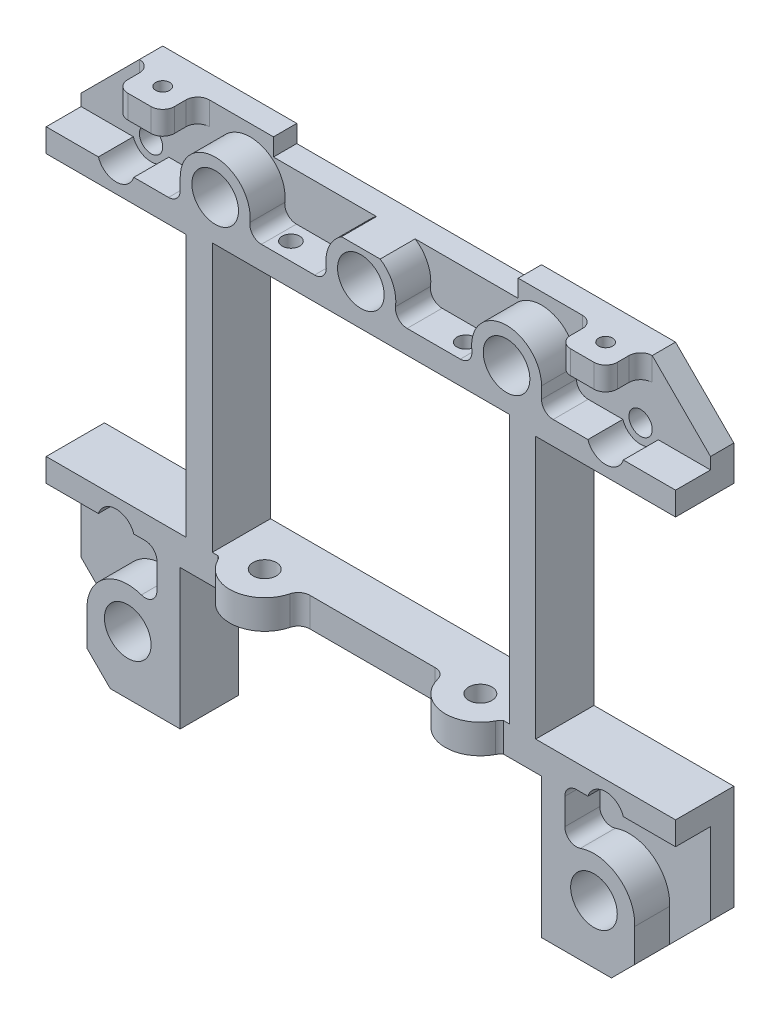
from build123d import *

# Parameters (mm, degrees)
SKETCH_1_R          = 2
SKETCH_1_R_2        = 1
SKETCH_1_W          = 25.5
SKETCH_1_H          = 23
EXTRUDE_1_DEPTH     = 2
SKETCH_3_R          = 1
EXTRUDE_2_DEPTH     = 2.5
SKETCH_4_R          = 2
SKETCH_4_W          = 4
SKETCH_4_H          = 2
EXTRUDE_3_DEPTH     = 3
FILLET_1_R          = 1
FILLET_2_R          = 1
SKETCH_5_W          = 12.5
SKETCH_5_H          = 2.5
EXTRUDE_4_DEPTH     = 2
FILLET_3_R          = 1
SKETCH_6_R          = 2
CUT_EXTRUDE_1_DEPTH = 1
SKETCH_7_R          = 0.75
CUT_EXTRUDE_2_DEPTH = 2.5
SKETCH_8_R          = 0.6
CUT_EXTRUDE_3_DEPTH = 3
SKETCH1_W           = 21
SKETCH1_H           = 10
CUT_EXTRUDE1_DEPTH  = 1.5
SKETCH3_R           = 0.75
CUT_EXTRUDE2_DEPTH  = 11


with BuildPart() as part:
    # 草图1 → 凸台-拉伸1 (new body)
    with BuildSketch(Plane.XY):
        Polygon((-27, 25), (-15, 25), (-15, 2.5), (-27, 2.5), (-27, -6.5), (-21.5, -12), (-15.5, -12), (-15.5, 0), (15.5, 0), (15.5, -12), (21.5, -12), (27, -6.5), (27, 2.5), (15, 2.5), (15, 25), (27, 25), (27, 28), (22, 33), (-22, 33), (-27, 28), align=None)
        with Locations((20, -7)):
            Circle(SKETCH_1_R, mode=Mode.SUBTRACT)
        with Locations((12.5, 29)):
            Circle(SKETCH_1_R, mode=Mode.SUBTRACT)
        with Locations((0, 29)):
            Circle(SKETCH_1_R, mode=Mode.SUBTRACT)
        with Locations(Location((-20, -7, 0), (0, 0, 180))):
            Circle(SKETCH_1_R, mode=Mode.SUBTRACT)
        with Locations(Location((-12.5, 29, 0), (0, 0, 180))):
            Circle(SKETCH_1_R, mode=Mode.SUBTRACT)
        with Locations((21, 27.5)):
            Circle(SKETCH_1_R_2, mode=Mode.SUBTRACT)
        with Locations((21, 0)):
            Circle(SKETCH_1_R_2, mode=Mode.SUBTRACT)
        with Locations(Location((-21, 27.5, 0), (0, 0, 180))):
            Circle(SKETCH_1_R_2, mode=Mode.SUBTRACT)
        with Locations(Location((-21, 0, 0), (0, 0, 180))):
            Circle(SKETCH_1_R_2, mode=Mode.SUBTRACT)
        with Locations((0, 14)):
            Rectangle(SKETCH_1_W, SKETCH_1_H, mode=Mode.SUBTRACT)
    extrude(amount=EXTRUDE_1_DEPTH)

    # 草图3 → 凸台-拉伸2 (add)
    # profile 1 of 2: a face of its own
    with BuildSketch(Plane(origin=(0, 2.5, 0), x_dir=(1, 0, 0), z_dir=(0, 1, 0))):
        with BuildLine():
            Line((-6.25, -2), (-6.25, -4))
            ThreePointArc((-6.25, -4), (-9.25, -7), (-12.25, -4))
            Line((-12.25, -4), (-12.25, -2))
            Line((-12.25, -2), (-6.25, -2))
        make_face()
        with Locations(Location((-9.25, -4, 0), (0, 0, 180))):
            Circle(SKETCH_3_R, mode=Mode.SUBTRACT)
    # profile 2 of 2: a face of its own
    with BuildSketch(Plane(origin=(0, 2.5, 0), x_dir=(1, 0, 0), z_dir=(0, 1, 0))):
        with BuildLine():
            Line((12.25, -2), (6.25, -2))
            Line((6.25, -2), (6.25, -4))
            ThreePointArc((6.25, -4), (9.25, -7), (12.25, -4))
            Line((12.25, -4), (12.25, -2))
        make_face()
        with Locations((9.25, -4)):
            Circle(SKETCH_3_R, mode=Mode.SUBTRACT)
    extrude(amount=-EXTRUDE_2_DEPTH)

    # 草图4 → 凸台-拉伸3 (add)
    # profile 1 of 3: a face of its own
    with BuildSketch(Plane.XY.offset(2)):
        with BuildLine():
            Line((-15.5, 29), (-15.5, 27))
            Line((-15.5, 27), (-19.480131585, 27))
            ThreePointArc((-19.480131585, 27), (-21, 25.9), (-22.519868415, 27))
            Line((-22.519868415, 27), (-27, 27))
            Line((-27, 27), (-27, 25))
            Line((-27, 25), (-16.5, 25))
            Line((-16.5, 25), (-15, 25))
            Line((-15, 25), (-15, 2.5))
            Line((-15, 2.5), (-27, 2.5))
            Line((-27, 2.5), (-27, 0.5))
            Line((-27, 0.5), (-25, 0.5))
            Line((-25, 0.5), (-22.519868415, 0.5))
            ThreePointArc((-22.519868415, 0.5), (-21, 1.6), (-19.480131585, 0.5))
            Line((-19.480131585, 0.5), (-17.5, 0.5))
            Line((-17.5, 0.5), (-17.5, -4.550510257))
            ThreePointArc((-17.5, -4.550510257), (-21.403955533, -3.793926254), (-23.495572013, -7.176000862))
            Line((-23.495572013, -7.176000862), (-23.495572013, -10.004427987))
            Line((-23.495572013, -10.004427987), (-21.5, -12))
            Line((-21.5, -12), (-15.5, -12))
            Line((-15.5, -12), (-15.5, 0))
            Line((-15.5, 0), (-12.25, 0))
            Line((-12.25, 0), (-12.25, 2.5))
            Line((-12.25, 2.5), (-12.75, 2.5))
            Line((-12.75, 2.5), (-12.75, 25.5))
            Line((-12.75, 25.5), (12.75, 25.5))
            Line((12.75, 25.5), (12.75, 2.5))
            Line((12.75, 2.5), (12.25, 2.5))
            Line((12.25, 2.5), (12.25, 0))
            Line((12.25, 0), (15.5, 0))
            Line((15.5, 0), (15.5, -12))
            Line((15.5, -12), (21.5, -12))
            Line((21.5, -12), (23.495572013, -10.004427987))
            Line((23.495572013, -10.004427987), (23.495572013, -7.176000862))
            ThreePointArc((23.495572013, -7.176000862), (21.403955533, -3.793926254), (17.5, -4.550510257))
            Line((17.5, -4.550510257), (17.5, 0.5))
            Line((17.5, 0.5), (19.480131585, 0.5))
            ThreePointArc((19.480131585, 0.5), (21, 1.6), (22.519868415, 0.5))
            Line((22.519868415, 0.5), (25, 0.5))
            Line((25, 0.5), (27, 0.5))
            Line((27, 0.5), (27, 2.5))
            Line((27, 2.5), (15, 2.5))
            Line((15, 2.5), (15, 25))
            Line((15, 25), (16.5, 25))
            Line((16.5, 25), (27, 25))
            Line((27, 25), (27, 27))
            Line((27, 27), (22.519868415, 27))
            ThreePointArc((22.519868415, 27), (21, 25.9), (19.480131585, 27))
            Line((19.480131585, 27), (15.5, 27))
            Line((15.5, 27), (15.5, 29))
            ThreePointArc((15.5, 29), (11.723542865, 31.897777479), (9.901923789, 27.5))
            Line((9.901923789, 27.5), (2.598076211, 27.5))
            ThreePointArc((2.598076211, 27.5), (0, 32), (-2.598076211, 27.5))
            Line((-2.598076211, 27.5), (-9.901923789, 27.5))
            ThreePointArc((-9.901923789, 27.5), (-11.723542865, 31.897777479), (-15.5, 29))
        make_face()
        with Locations((20, -7)):
            Circle(SKETCH_4_R, mode=Mode.SUBTRACT)
        with Locations((12.5, 29)):
            Circle(SKETCH_4_R, mode=Mode.SUBTRACT)
        with Locations((0, 29)):
            Circle(SKETCH_4_R, mode=Mode.SUBTRACT)
        with Locations(Location((-12.5, 29, 0), (0, 0, 180))):
            Circle(SKETCH_4_R, mode=Mode.SUBTRACT)
        with Locations(Location((-20, -7, 0), (0, 0, 180))):
            Circle(SKETCH_4_R, mode=Mode.SUBTRACT)
    # profile 2 of 3: a face of its own
    with BuildSketch(Plane.XY.offset(2)):
        with Locations((-19, 32)):
            Rectangle(SKETCH_4_W, SKETCH_4_H)
    # profile 3 of 3: a face of its own
    with BuildSketch(Plane.XY.offset(2)):
        with Locations((19, 32)):
            Rectangle(SKETCH_4_W, SKETCH_4_H)
    extrude(amount=EXTRUDE_3_DEPTH)

    # 圆角1
    # the kernel refuses this fillet: 1 mm, written as the material it adds along each edge
    with BuildSketch(Plane(origin=(17.5, -4.550510257, 2), x_dir=(0, 1, 0), z_dir=(0, 0, 1))) as fillet_1_piece_1:
        with BuildLine():
            CenterArc((1.793150944, -1), FILLET_1_R, 90, 109.471220634)
            ThreePointArc((0.850341903, -1.333333333), (0.5014624, -0.618011305), (0, 0))
            Line((0, 0), (1.793150944, 0))
        make_face()
    extrude(amount=3)
    with BuildSketch(Plane(origin=(17.5, 0.5, 2), x_dir=(1, 0, 0), z_dir=(0, 0, 1)), Plane(origin=(15.5, 27, 2), x_dir=(0, 1, 0), z_dir=(0, 0, 1)), Plane(origin=(-15.5, 27, 2), x_dir=(-1, 0, 0), z_dir=(0, 0, 1)), Plane(origin=(-17.5, 0.5, 2), x_dir=(0, -1, 0), z_dir=(0, 0, 1))) as fillet_1_piece_2:
        with BuildLine():
            CenterArc((FILLET_1_R, -FILLET_1_R), FILLET_1_R, 90, 90)
            Line((0, -FILLET_1_R), (0, 0))
            Line((0, 0), (FILLET_1_R, 0))
        make_face()
    extrude(amount=3)
    with BuildSketch(Plane(origin=(9.901923789, 27.5, 2), x_dir=(-1, 0, 0), z_dir=(0, 0, 1)), Plane(origin=(-2.598076211, 27.5, 2), x_dir=(-1, 0, 0), z_dir=(0, 0, 1))) as fillet_1_piece_3:
        with BuildLine():
            CenterArc((1.370550755, -1), FILLET_1_R, 90, 97.180755781)
            ThreePointArc((0.378394014, -1.125), (0.245389674, -0.543599583), (0, 0))
            Line((0, 0), (1.370550755, 0))
        make_face()
    extrude(amount=3)
    with BuildSketch(Plane(origin=(2.598076211, 27.5, 2), x_dir=(0.31880013895525616, 0.9478219618694798, 0), z_dir=(0, 0, 1)), Plane(origin=(-9.901923789, 27.5, 2), x_dir=(0.3188001389552541, 0.9478219618694803, 0), z_dir=(0, 0, 1))) as fillet_1_piece_4:
        with BuildLine():
            CenterArc((1.384753733, -0.980237967), FILLET_1_R, 101.409622109, 97.180755781)
            Line((0.436931771, -1.299038106), (0, 0))
            ThreePointArc((0, 0), (0.593465886, -0.0592861), (1.186931771, 0))
        make_face()
    extrude(amount=3)
    with BuildSketch(Plane(origin=(-17.5, -4.550510257, 2), x_dir=(-0.8431291837491304, 0.5377110557823086, 0), z_dir=(0, 0, 1))) as fillet_1_piece_5:
        with BuildLine():
            CenterArc((1.807326271, -0.974146836), FILLET_1_R, 103.056735384, 109.471220635)
            Line((0.964197087, -1.511857892), (0, 0))
            ThreePointArc((0, 0), (0.790705244, -0.090486073), (1.581410487, 0))
        make_face()
    extrude(amount=3)
    with BuildSketch(Plane(origin=(-21, 33, 2), x_dir=(-1, 0, 0), z_dir=(0, -1, 0)), Plane(origin=(-17, 31, 2), x_dir=(1, 0, 0), z_dir=(0, 1, 0))) as fillet_1_piece_6:
        with BuildLine():
            CenterArc((FILLET_1_R, -FILLET_1_R), FILLET_1_R, 90, 90)
            Line((0, -FILLET_1_R), (0, 0))
            Line((0, 0), (FILLET_1_R, 0))
        make_face()
    extrude(amount=2)
    with BuildSketch(Plane(origin=(17, 31, 2), x_dir=(-1, 0, 0), z_dir=(0, 1, 0)), Plane(origin=(21, 33, 2), x_dir=(1, 0, 0), z_dir=(0, -1, 0))) as fillet_1_piece_7:
        with BuildLine():
            CenterArc((FILLET_1_R, FILLET_1_R), FILLET_1_R, 180, 90)
            Line((0, FILLET_1_R), (0, 0))
            Line((0, 0), (FILLET_1_R, 0))
        make_face()
    extrude(amount=2)
    # the kernel refuses this fillet: 1 mm, written as the material it takes off along each edge
    with BuildSketch(Plane(origin=(-21, 35.5, 5), x_dir=(0, 0, -1), z_dir=(0, -1, 0)), Plane(origin=(21, 35.5, 5), x_dir=(-1, 0, 0), z_dir=(0, -1, 0))) as fillet_1_2_piece_1:
        with BuildLine():
            CenterArc((FILLET_1_R, FILLET_1_R), FILLET_1_R, 180, 90)
            Line((0, FILLET_1_R), (0, 0))
            Line((0, 0), (FILLET_1_R, 0))
        make_face()
    extrude(amount=7, mode=Mode.SUBTRACT)
    with BuildSketch(Plane(origin=(-17, 28.5, 5), x_dir=(-1, 0, 0), z_dir=(0, 1, 0)), Plane(origin=(17, 28.5, 5), x_dir=(0, 0, -1), z_dir=(0, 1, 0))) as fillet_1_2_piece_2:
        with BuildLine():
            CenterArc((FILLET_1_R, -FILLET_1_R), FILLET_1_R, 90, 90)
            Line((0, -FILLET_1_R), (0, 0))
            Line((0, 0), (FILLET_1_R, 0))
        make_face()
    extrude(amount=7, mode=Mode.SUBTRACT)

    # 圆角2
    # the kernel refuses this fillet: 1 mm, written as the material it adds along each edge
    with BuildSketch(Plane(origin=(-12.25, 2.5, 4), x_dir=(0, 0, 1), z_dir=(0, -1, 0))) as fillet_2_piece_1:
        with BuildLine():
            CenterArc((1.830947502, 0.556350833), FILLET_2_R, 213.80380727, 28.955024372)
            ThreePointArc((1.373210626, -0.332736875), (0.706473859, -0.084370619), (0, 0))
            Line((0, 0), (1, 0))
        make_face()
    extrude(amount=2.5)
    with BuildSketch(Plane(origin=(12.25, 2.5, 4), x_dir=(0, 0, 1), z_dir=(0, -1, 0))) as fillet_2_piece_2:
        with BuildLine():
            CenterArc((1.830947502, -0.556350833), FILLET_2_R, 117.241168358, 28.955024372)
            ThreePointArc((1.373210626, 0.332736875), (0.706473859, 0.084370619), (0, 0))
            Line((0, 0), (1, 0))
        make_face()
    extrude(amount=2.5)

    # 草图5 → 凸台-拉伸4 (add)
    with BuildSketch(Plane.XY.offset(2)):
        with Locations((0, 1.25)):
            Rectangle(SKETCH_5_W, SKETCH_5_H)
    extrude(amount=EXTRUDE_4_DEPTH)

    # 圆角3
    fillet_3_edges = [part.edges().sort_by_distance(p)[0] for p in [
        (-6.25, 1.25, 4),
        (6.25, 1.25, 4),
    ]]
    fillet(fillet_3_edges, radius=FILLET_3_R)

    # 草图6 → 切除-拉伸1 (cut)
    with BuildSketch(Plane.XZ):
        with Locations((-9.25, 4)):
            Circle(SKETCH_6_R)
        with Locations((9.25, 4)):
            Circle(SKETCH_6_R)
    extrude(amount=-CUT_EXTRUDE_1_DEPTH, mode=Mode.SUBTRACT)

    # 草图7 → 切除-拉伸2 (cut)
    with BuildSketch(Plane.XZ.offset(12)):
        with Locations((19, 2.5)):
            Circle(SKETCH_7_R)
        with Locations(Location((-19, 2.5, 0), (0, 0, 180))):
            Circle(SKETCH_7_R)
    extrude(amount=-CUT_EXTRUDE_2_DEPTH, mode=Mode.SUBTRACT)

    # 草图8 → 切除-拉伸3 (cut)
    with BuildSketch(Plane(origin=(0, 33, 0), x_dir=(1, 0, 0), z_dir=(0, 1, 0))):
        with Locations(Location((-19, -3, 0), (0, 0, 180))):
            Circle(SKETCH_8_R)
        with Locations(Location((19, -3, 0), (0, 0, 270))):
            Circle(SKETCH_8_R)
    extrude(amount=-CUT_EXTRUDE_3_DEPTH, mode=Mode.SUBTRACT)

    # Sketch1 → Cut-Extrude1 (cut)
    with BuildSketch(Plane(origin=(0, 33, 0), x_dir=(1, 0, 0), z_dir=(0, 1, 0))):
        with Locations((0, -3)):
            Rectangle(SKETCH1_W, SKETCH1_H)
    extrude(amount=-CUT_EXTRUDE1_DEPTH, mode=Mode.SUBTRACT)

    # Sketch3 → Cut-Extrude2 (cut)
    with BuildSketch(Plane(origin=(0, 27.5, 0), x_dir=(1, 0, 0), z_dir=(0, 1, 0))):
        with Locations(Location((-7.5, -3.5, 0), (0, 0, 270))):
            Circle(SKETCH3_R)
        with Locations((7.5, -3.5)):
            Circle(SKETCH3_R)
    extrude(amount=-CUT_EXTRUDE2_DEPTH, mode=Mode.SUBTRACT)


solid = part.part
